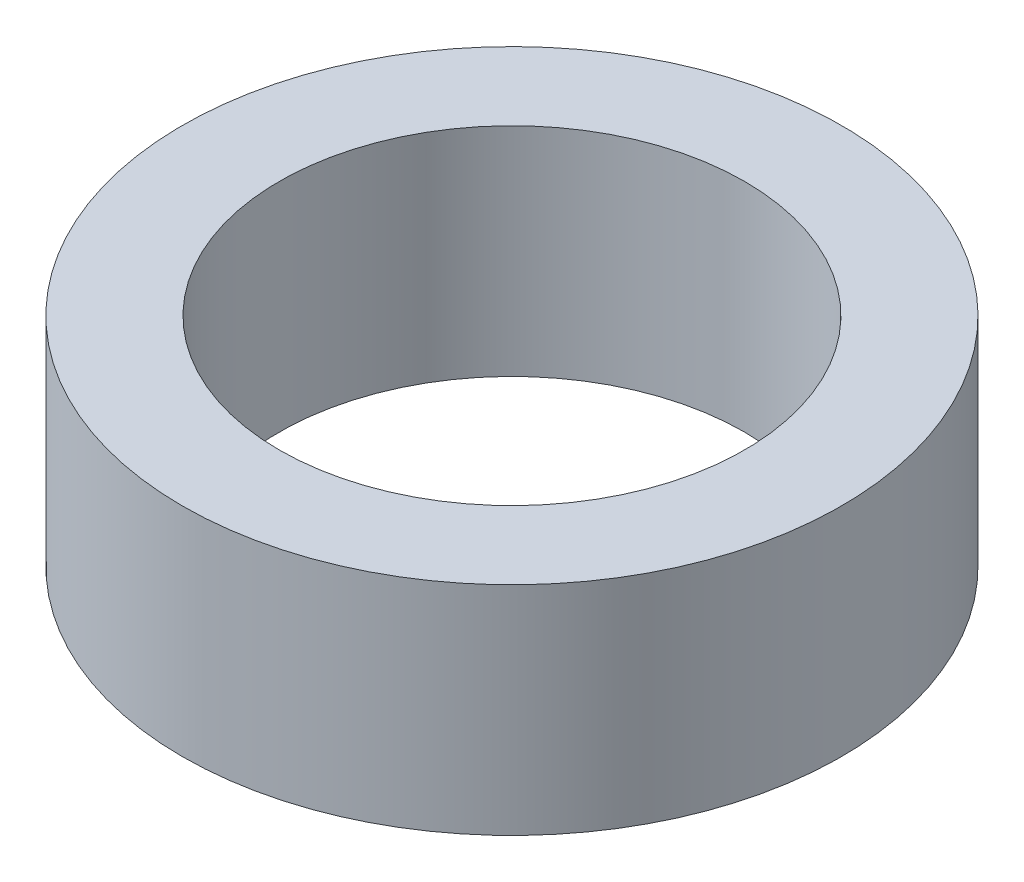
from build123d import *

# Parameters (mm, degrees)
SKETCH1_R           = 42.5
BOSS_EXTRUDE1_DEPTH = 28
SKETCH2_R           = 30
CUT_EXTRUDE1_DEPTH  = 67.306108316


with BuildPart() as part:
    # Sketch1 → Boss-Extrude1 (new body)
    with BuildSketch(Plane(origin=(0, 0, 0), x_dir=(1, 0, 0), z_dir=(0, 1, 0))):
        Circle(SKETCH1_R)
    extrude(amount=BOSS_EXTRUDE1_DEPTH)

    # Sketch2 → Cut-Extrude1 (cut, through all)
    with BuildSketch(Plane(origin=(0, 0, 0), x_dir=(1, 0, 0), z_dir=(0, 1, 0))):
        Circle(SKETCH2_R)
    extrude(amount=CUT_EXTRUDE1_DEPTH, mode=Mode.SUBTRACT)


solid = part.part
